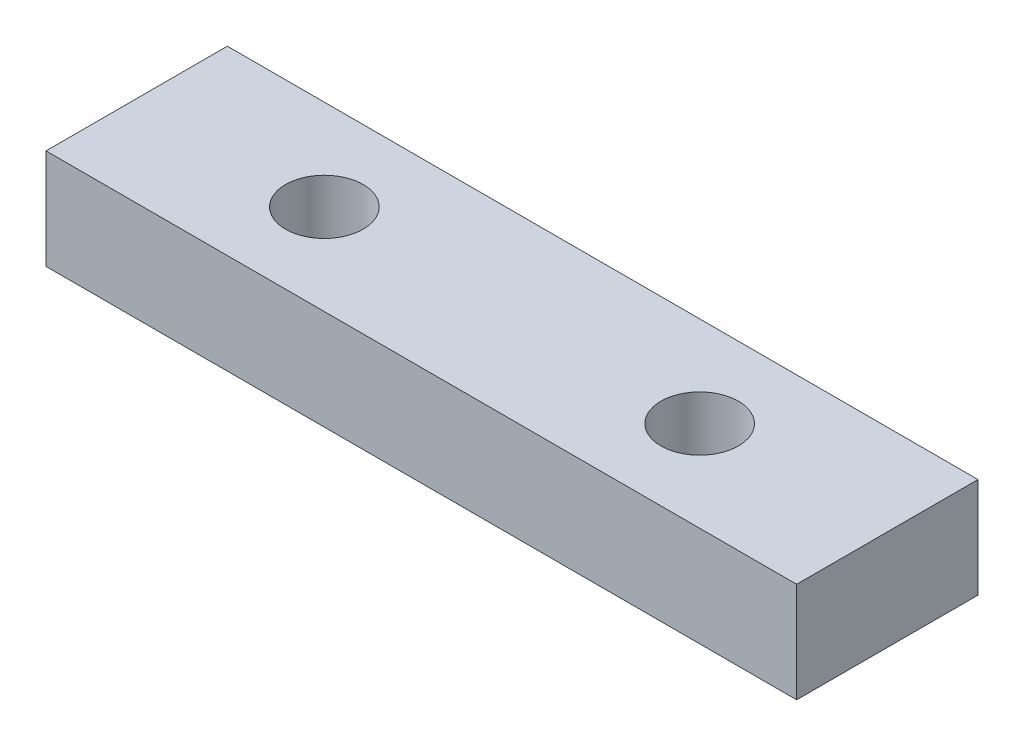
from build123d import *

# Parameters (mm, degrees)
SKETCH1_W           = 30
SKETCH1_H           = 7.247877258
SKETCH1_R           = 1.55
BOSS_EXTRUDE1_DEPTH = 4


with BuildPart() as part:
    # Sketch1 → Boss-Extrude1 (new body)
    with BuildSketch(Plane(origin=(0, 0, 0), x_dir=(1, 0, 0), z_dir=(0, 1, 0))):
        with Locations((0, -3.623938629)):
            Rectangle(SKETCH1_W, SKETCH1_H)
        with Locations((7.5, -3.623938629)):
            Circle(SKETCH1_R, mode=Mode.SUBTRACT)
        with Locations((-7.5, -3.623938629)):
            Circle(SKETCH1_R, mode=Mode.SUBTRACT)
    extrude(amount=BOSS_EXTRUDE1_DEPTH)


solid = part.part
